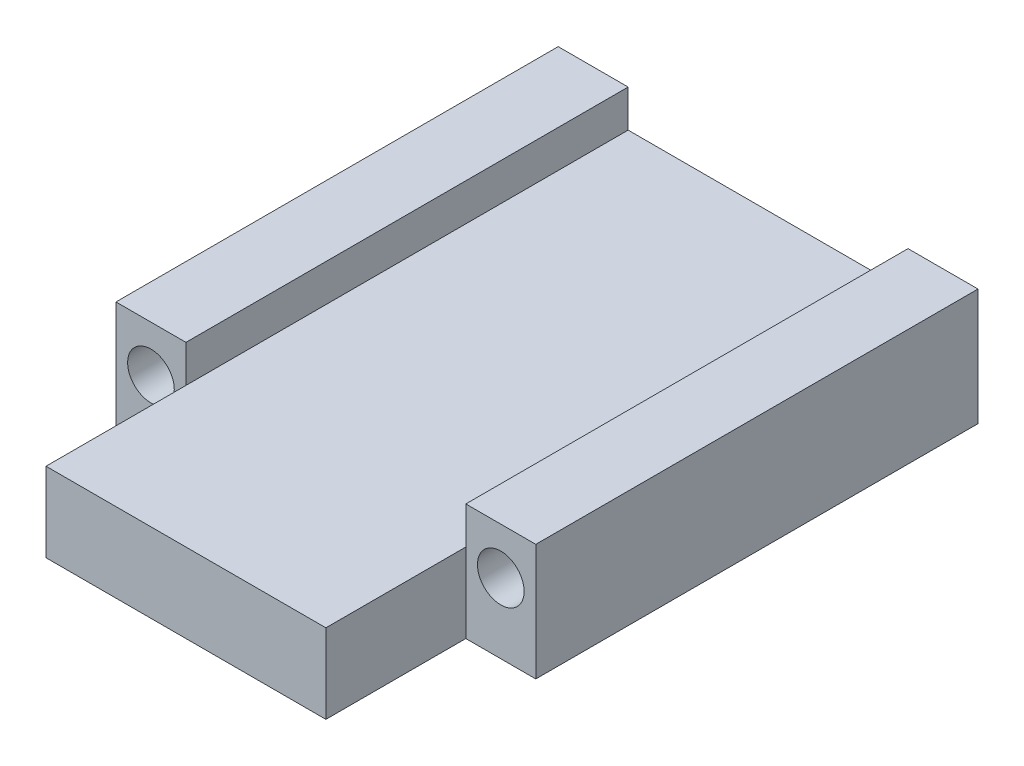
from build123d import *

# Parameters (mm, degrees)
SKETCH1_W                           = 28.575
SKETCH1_H                           = 7.9375
BOSS_EXTRUDE1_DEPTH                 = 39.624
SKETCH2_W                           = 19.05
SKETCH2_H                           = 2.54
CUT_EXTRUDE1_DEPTH                  = 43.307741713
F_1_8_0_125_CLEARANCE_DOWEL_HOLE1_D = 3.175
SKETCH6_W                           = 4.7625
SKETCH6_H                           = 7.9375
CUT_EXTRUDE2_DEPTH                  = 9.525


with BuildPart() as part:
    # Sketch1 → Boss-Extrude1 (new body)
    with BuildSketch(Plane.XY):
        Rectangle(SKETCH1_W, SKETCH1_H)
    extrude(amount=BOSS_EXTRUDE1_DEPTH)

    # Sketch2 → Cut-Extrude1 (cut, through all)
    with BuildSketch(Plane.XY.offset(39.624)):
        with Locations((0, 2.69875)):
            Rectangle(SKETCH2_W, SKETCH2_H)
    extrude(amount=-CUT_EXTRUDE1_DEPTH, mode=Mode.SUBTRACT)

    # 1/8 (0.125) Clearance Dowel Hole1 (through all)
    with Locations(Plane(origin=(0, 0, 0), x_dir=(-1, 0, 0), z_dir=(0, 0, -1))):
        with Locations((-11.90625, 0.79375), (11.90625, 0.79375)):
            Hole(F_1_8_0_125_CLEARANCE_DOWEL_HOLE1_D / 2)

    # Sketch6 → Cut-Extrude2 (cut)
    with BuildSketch(Plane.XY.offset(39.624)):
        with Locations((-11.90625, 0)):
            Rectangle(SKETCH6_W, SKETCH6_H)
        with Locations((11.90625, 0)):
            Rectangle(SKETCH6_W, SKETCH6_H)
    extrude(amount=-CUT_EXTRUDE2_DEPTH, mode=Mode.SUBTRACT)


solid = part.part
